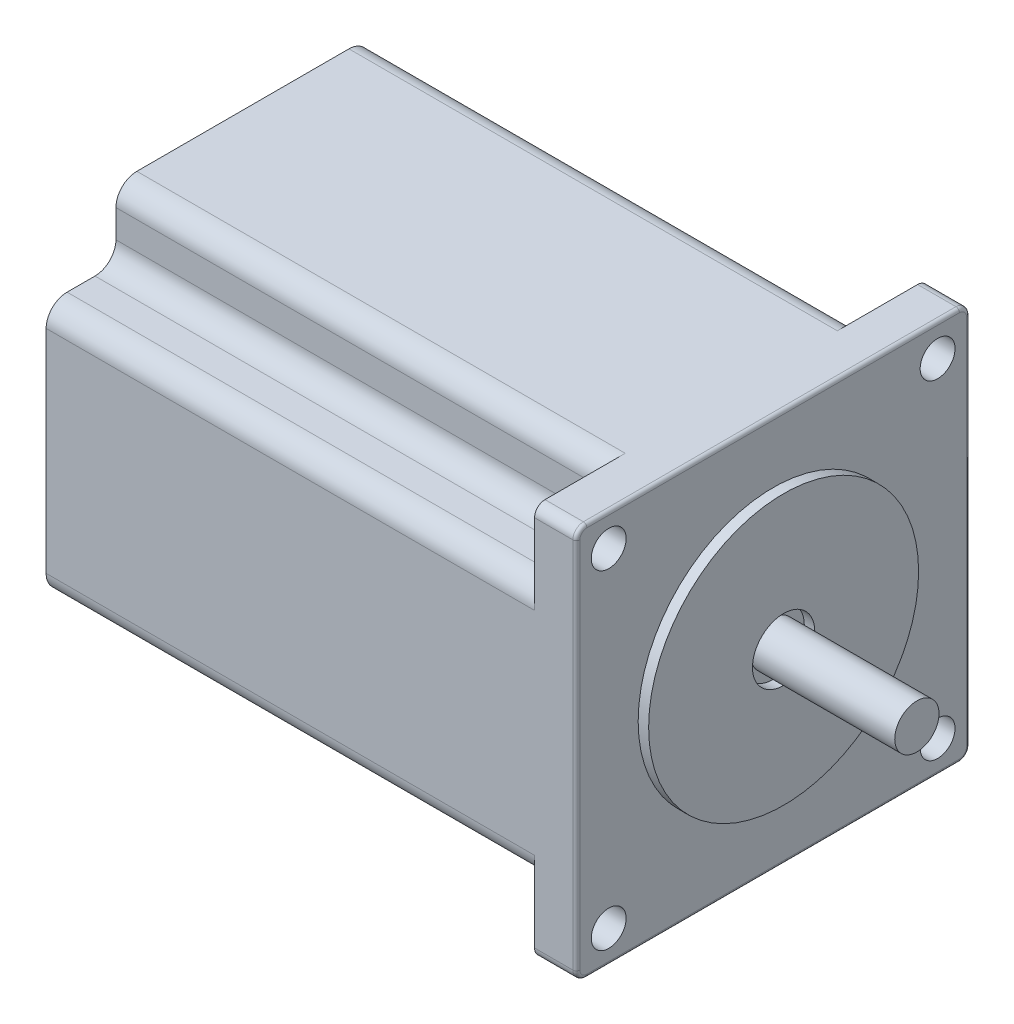
from build123d import *

# Parameters (mm, degrees)
SKETCH1_W           = 76
SKETCH1_H           = 56.4
BOSS_EXTRUDE1_DEPTH = 56.4
SKETCH2_W           = 70
SKETCH2_H           = 10
CUT_EXTRUDE1_DEPTH  = 10
SKETCH3_W           = 70
SKETCH3_H           = 10
CUT_EXTRUDE4_DEPTH  = 10
SKETCH5_W           = 70
SKETCH5_H           = 10
CUT_EXTRUDE5_DEPTH  = 10
FILLET2_R           = 3
FILLET3_R           = 3
SKETCH7_R           = 5
CUT_EXTRUDE6_DEPTH  = 5
FILLET4_R           = 1
FILLET5_R           = 0.5
FILLET6_R           = 1.5
FILLET7_R           = 1.5
SKETCH18_R          = 2.5
CUT_EXTRUDE7_DEPTH  = 10
SKETCH20_R          = 3.175
BOSS_EXTRUDE2_DEPTH = 20.6
SKETCH21_R          = 19.348505468
SKETCH21_R_2        = 4.468295999
BOSS_EXTRUDE3_DEPTH = 1.5


with BuildPart() as part:
    # Sketch1 → Boss-Extrude1 (new body)
    with BuildSketch(Plane(origin=(0, 0, 0), x_dir=(1, 0, 0), z_dir=(0, 1, 0))):
        with Locations((-12.257828935, -10.875461997)):
            Rectangle(SKETCH1_W, SKETCH1_H)
    extrude(amount=BOSS_EXTRUDE1_DEPTH)

    # Sketch2 → Cut-Extrude1 (cut)
    with BuildSketch(Plane.XY.offset(39.075461997)):
        with Locations((-15.257828935, 51.4)):
            Rectangle(SKETCH2_W, SKETCH2_H)
    extrude(amount=-CUT_EXTRUDE1_DEPTH, mode=Mode.SUBTRACT)

    # Sketch3 → Cut-Extrude4 (cut)
    with BuildSketch(Plane(origin=(0, 0, -17.324538003), x_dir=(-1, 0, 0), z_dir=(0, 0, -1))):
        with Locations((15.257828935, 51.4)):
            Rectangle(SKETCH3_W, SKETCH3_H)
        with Locations((15.257828935, 5)):
            Rectangle(SKETCH3_W, SKETCH3_H)
    extrude(amount=-CUT_EXTRUDE4_DEPTH, mode=Mode.SUBTRACT)

    # Sketch5 → Cut-Extrude5 (cut)
    with BuildSketch(Plane.XZ):
        with Locations((-15.257828935, 34.075461997)):
            Rectangle(SKETCH5_W, SKETCH5_H)
    extrude(amount=-CUT_EXTRUDE5_DEPTH, mode=Mode.SUBTRACT)

    # Fillet2
    fillet2_edges = [part.edges().sort_by_distance(p)[0] for p in [
        (-15.257828935, 56.4, 29.075461997),
        (-15.257828935, 46.4, 39.075461997),
        (-15.257828935, 0, -7.324538003),
        (-15.257828935, 10, -17.324538003),
        (-15.257828935, 56.4, -7.324538003),
        (-15.257828935, 46.4, -17.324538003),
        (-15.257828935, 10, 39.075461997),
        (-15.257828935, 0, 29.075461997),
    ]]
    fillet(fillet2_edges, radius=FILLET2_R)

    # Fillet3
    fillet3_edges = [part.edges().sort_by_distance(p)[0] for p in [
        (-15.257828935, 46.4, 29.075461997),
        (-15.257828935, 10, -7.324538003),
        (-15.257828935, 46.4, -7.324538003),
        (-15.257828935, 10, 29.075461997),
    ]]
    fillet(fillet3_edges, radius=FILLET3_R)

    # Sketch7 → Cut-Extrude6 (cut)
    with BuildSketch(Plane.ZY.offset(50.257828935)):
        with Locations((11.575461997, 27.5)):
            Circle(SKETCH7_R)
    extrude(amount=-CUT_EXTRUDE6_DEPTH, mode=Mode.SUBTRACT)

    # Fillet4
    fillet4_edges = [part.edges().sort_by_distance(p)[0] for p in [
        (-50.257828935, 27.5, 6.575461997),
    ]]
    fillet(fillet4_edges, radius=FILLET4_R)

    # Fillet5
    fillet5_edges = [part.edges().sort_by_distance(p)[0] for p in [
        (25.742171065, 56.4, 10.875461997),
        (25.742171065, 0, 10.875461997),
        (25.742171065, 28.2, -17.324538003),
        (25.742171065, 28.2, 39.075461997),
    ]]
    fillet(fillet5_edges, radius=FILLET5_R)

    # Fillet6
    # the kernel refuses this fillet: 1.5 mm, written as the material it takes off along each edge
    with BuildSketch(Plane(origin=(25.742171065, 54.9, 37.575461997), x_dir=(0, 1, 0), z_dir=(0, 0, -1))) as fillet6_piece_1:
        with BuildLine():
            CenterArc((1, -0.5), 0.5, 0, 90)
            Line((1.5, -0.5), (1.5, 0))
            Line((1.5, 0), (1, 0))
        make_face()
    revolve(axis=Axis((25.742171065, 54.9, 37.575461997), (1, 0, 0)), revolution_arc=90, mode=Mode.SUBTRACT)
    with BuildSketch(Plane(origin=(25.742171065, 56.4, 39.075461997), x_dir=(0, -1, 0), z_dir=(-1, 0, 0))) as fillet6_piece_2:
        with BuildLine():
            CenterArc((FILLET6_R, -FILLET6_R), FILLET6_R, 90, 90)
            Line((0, -FILLET6_R), (0, 0))
            Line((0, 0), (FILLET6_R, 0))
        make_face()
    extrude(amount=9.75, mode=Mode.SUBTRACT)

    # Fillet7
    # the kernel refuses this fillet: 1.5 mm, written as the material it takes off along each edge
    with BuildSketch(Plane(origin=(25.742171065, 1.5, 37.575461997), x_dir=(0, 0, 1), z_dir=(0, 1, 0))) as fillet7_piece_1:
        with BuildLine():
            CenterArc((1, -0.5), 0.5, 0, 90)
            Line((1.5, -0.5), (1.5, 0))
            Line((1.5, 0), (1, 0))
        make_face()
    revolve(axis=Axis((25.742171065, 1.5, 37.575461997), (1, 0, 0)), revolution_arc=90, mode=Mode.SUBTRACT)
    with BuildSketch(Plane(origin=(25.742171065, 54.9, -15.824538003), x_dir=(0, 0, -1), z_dir=(0, -1, 0))) as fillet7_piece_2:
        with BuildLine():
            CenterArc((1, -0.5), 0.5, 0, 90)
            Line((1.5, -0.5), (1.5, 0))
            Line((1.5, 0), (1, 0))
        make_face()
    revolve(axis=Axis((25.742171065, 54.9, -15.824538003), (1, 0, 0)), revolution_arc=90, mode=Mode.SUBTRACT)
    with BuildSketch(Plane(origin=(25.742171065, 1.5, -15.824538003), x_dir=(0, -1, 0), z_dir=(0, 0, 1))) as fillet7_piece_3:
        with BuildLine():
            CenterArc((1, -0.5), 0.5, 0, 90)
            Line((1.5, -0.5), (1.5, 0))
            Line((1.5, 0), (1, 0))
        make_face()
    revolve(axis=Axis((25.742171065, 1.5, -15.824538003), (1, 0, 0)), revolution_arc=90, mode=Mode.SUBTRACT)
    with BuildSketch(Plane(origin=(15.992171065, 56.4, -17.324538003), x_dir=(0, -1, 0), z_dir=(1, 0, 0)), Plane(origin=(15.992171065, 0, -17.324538003), x_dir=(0, 0, 1), z_dir=(1, 0, 0)), Plane(origin=(25.742171065, 0, 39.075461997), x_dir=(0, 0, -1), z_dir=(-1, 0, 0))) as fillet7_piece_4:
        with BuildLine():
            CenterArc((FILLET7_R, -FILLET7_R), FILLET7_R, 90, 90)
            Line((0, -FILLET7_R), (0, 0))
            Line((0, 0), (FILLET7_R, 0))
        make_face()
    extrude(amount=9.75, mode=Mode.SUBTRACT)

    # Sketch18 → Cut-Extrude7 (cut)
    with BuildSketch(Plane(origin=(25.742171065, 0, 0), x_dir=(0, 0, -1), z_dir=(1, 0, 0))):
        with Locations((-34.445461997, 51.77)):
            Circle(SKETCH18_R)
        with Locations((12.694538003, 51.77)):
            Circle(SKETCH18_R)
        with Locations((12.694538003, 4.63)):
            Circle(SKETCH18_R)
        with Locations((-34.445461997, 4.63)):
            Circle(SKETCH18_R)
    extrude(amount=-CUT_EXTRUDE7_DEPTH, mode=Mode.SUBTRACT)

    # Sketch20 → Boss-Extrude2 (add)
    with BuildSketch(Plane(origin=(25.742171065, 0, 0), x_dir=(0, 0, -1), z_dir=(1, 0, 0))):
        with Locations(Location((-10.875461997, 28.2, 0), (0, 0, 180))):
            Circle(SKETCH20_R)
    extrude(amount=BOSS_EXTRUDE2_DEPTH)

    # Sketch21 → Boss-Extrude3 (add)
    with BuildSketch(Plane(origin=(25.742171065, 0, 0), x_dir=(0, 0, -1), z_dir=(1, 0, 0))):
        with Locations(Location((-10.875461997, 28.2, 0), (0, 0, 180))):
            Circle(SKETCH21_R)
        with Locations((-10.875461997, 28.2)):
            Circle(SKETCH21_R_2, mode=Mode.SUBTRACT)
    extrude(amount=BOSS_EXTRUDE3_DEPTH)


solid = part.part
